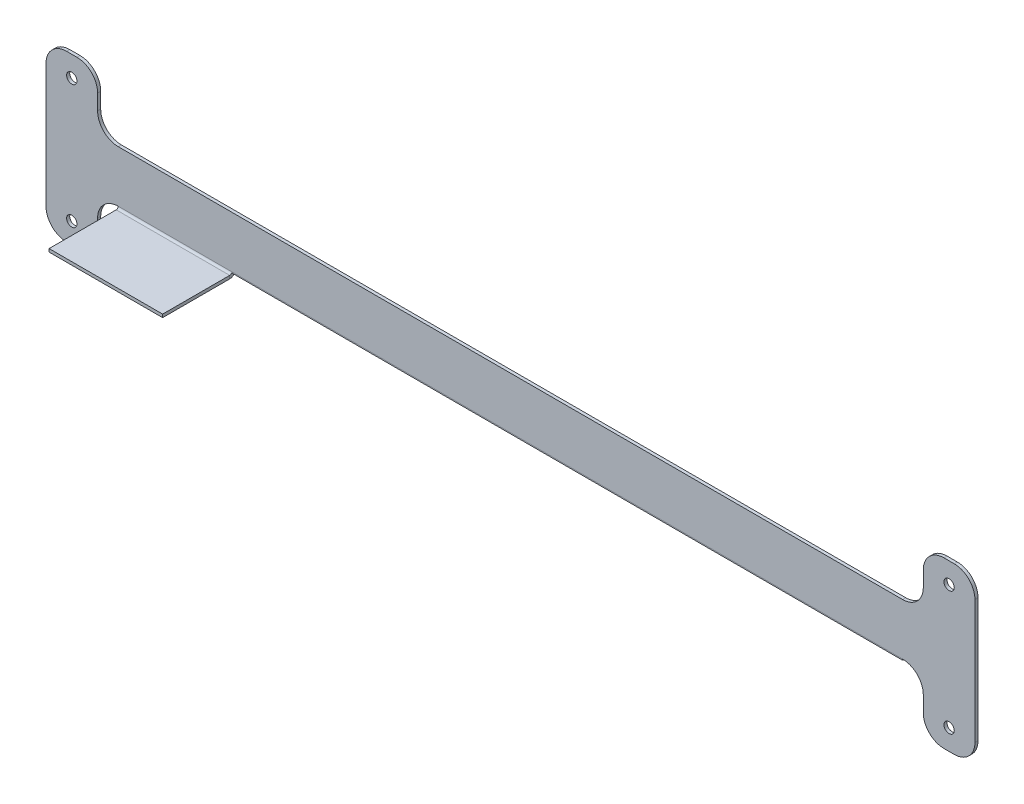
from build123d import *

# Parameters (mm, degrees)
SKETCH1_W           = 700
SKETCH1_H           = 50
SKETCH1_W_2         = 50
SKETCH1_R           = 5
SKETCH1_H_2         = 160
BOSS_EXTRUDE1_DEPTH = 3
FILLET1_R           = 20
EDGE_FLANGE1_DEPTH  = 760
CUT_EXTRUDE1_START  = 80
CUT_EXTRUDE1_DEPTH  = 650


# Read off the part's stored shape, not the designer's step: Cut-Extrude1
# Sheet-metal steps are written as plain solids
with BuildPart() as part:
    # Sketch1 → Boss-Extrude1 (new body)
    # profile 1 of 5: a face of its own
    with BuildSketch(Plane.XY):
        with Locations((350, 25)):
            Rectangle(SKETCH1_W, SKETCH1_H)
    # profile 2 of 5: a face of its own
    with BuildSketch(Plane.XY):
        with Locations((-25, 25)):
            Rectangle(SKETCH1_W_2, SKETCH1_H)
    # profile 3 of 5: a face of its own
    with BuildSketch(Plane.XY):
        Polygon((-50, -55), (-50, 0), (-50, 50), (-50, 105), (-100, 105), (-100, -55), align=None)
        with Locations((-75, -35)):
            Circle(SKETCH1_R, mode=Mode.SUBTRACT)
        with Locations((-75, 85)):
            Circle(SKETCH1_R, mode=Mode.SUBTRACT)
    # profile 4 of 5: a face of its own
    with BuildSketch(Plane.XY):
        with Locations((775, 25)):
            Rectangle(SKETCH1_W_2, SKETCH1_H_2)
        with Locations((775, -35)):
            Circle(SKETCH1_R, mode=Mode.SUBTRACT)
        with Locations((775, 85)):
            Circle(SKETCH1_R, mode=Mode.SUBTRACT)
    # profile 5 of 5: a face of its own
    with BuildSketch(Plane.XY):
        with Locations((725, 25)):
            Rectangle(SKETCH1_W_2, SKETCH1_H)
    extrude(amount=BOSS_EXTRUDE1_DEPTH)

    # Fillet1
    fillet1_edges = [part.edges().sort_by_distance(p)[0] for p in [
        (-50, 0, 1.5),
        (-50, -55, 1.5),
        (-100, -55, 1.5),
        (-100, 105, 1.5),
        (-50, 105, 1.5),
        (-50, 50, 1.5),
        (750, 50, 1.5),
        (750, 105, 1.5),
        (800, 105, 1.5),
        (800, -55, 1.5),
        (750, -55, 1.5),
        (750, 0, 1.5),
    ]]
    fillet(fillet1_edges, radius=FILLET1_R)

    # Edge-Flange1 section (across the edge) → Edge-Flange1 (add)
    with BuildSketch(Plane(origin=(-30, -2, 3), x_dir=(0, 1, 0), z_dir=(1, 0, 0))):
        with BuildLine():
            Line((-3, 2), (-3, 67))
            Line((-3, 67), (0, 67))
            Line((0, 67), (0, 2))
            ThreePointArc((0, 2), (0.585786438, 0.585786438), (2, 0))
            Line((2, 0), (2, -3))
            ThreePointArc((2, -3), (-1.535533906, -1.535533906), (-3, 2))
        make_face()
    extrude(amount=EDGE_FLANGE1_DEPTH)

    # Cut-Extrude1 outline → Cut-Extrude1 (cut)
    with BuildSketch(Plane.YZ.offset(CUT_EXTRUDE1_START)):
        with BuildLine():
            ThreePointArc((-5, 5), (-4.183300133, 2.261387212), (-2, 0.417424305))
            Line((-2, 0.417424305), (-0.8, 3.166969722))
            ThreePointArc((-0.8, 3.166969722), (-1.673320053, 3.904554885), (-2, 5))
            Line((-2, 5), (-2, 70))
            Line((-2, 70), (-5, 70))
            Line((-5, 70), (-5, 5))
        make_face()
    extrude(amount=CUT_EXTRUDE1_DEPTH, mode=Mode.SUBTRACT)


solid = part.part
